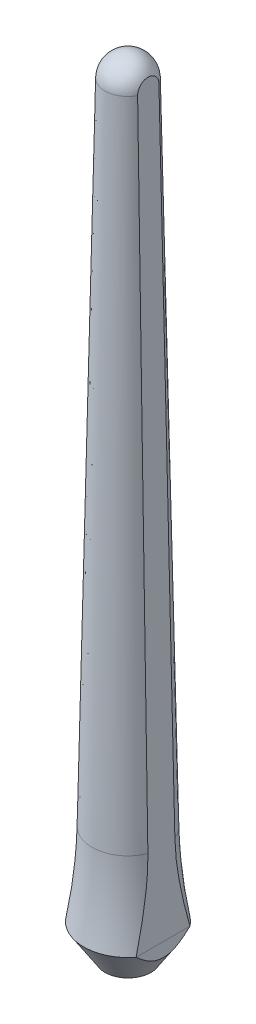
from build123d import *

# Parameters (mm, degrees)
SKETCH2_R          = 2.2
CUT_EXTRUDE1_DEPTH = 14
CUT_EXTRUDE2_DEPTH = 10
CHAMFER1_SIZE      = 0.2
CHAMFER1_SIZE2     = 0.746410162
CHAMFER2_SIZE      = 0.5


with BuildPart() as part:
    # Sketch1 → Revolve1 (revolve)
    with BuildSketch(Plane.XY):
        with BuildLine():
            Line((0, 0), (0, 120))
            ThreePointArc((0, 120), (2.450254417, 118.999536357), (3.5, 116.569987341))
            Line((3.5, 116.569987341), (5.5, 17.561999145))
            ThreePointArc((5.5, 17.561999145), (5.876826993, 11.256304757), (6.75, 5))
            Line((6.75, 5), (3.5, 0))
            Line((3.5, 0), (0, 0))
        make_face()
    revolve(axis=Axis((0, 0, 0), (0, -1, 0)))

    # Sketch2 → Cut-Extrude1 (cut)
    with BuildSketch(Plane.XZ):
        Circle(SKETCH2_R)
    extrude(amount=-CUT_EXTRUDE1_DEPTH, mode=Mode.SUBTRACT)

    # Sketch3 → Cut-Extrude2 (cut, symmetric)
    with BuildSketch(Plane.XY):
        Polygon((2.8286269, 130), (5.858685439, -20), (20, -20), (20, 130), align=None)
    extrude(amount=CUT_EXTRUDE2_DEPTH, both=True, mode=Mode.SUBTRACT)

    # Chamfer1
    chamfer1_edges = [part.edges().sort_by_distance(p)[0] for p in [
        (-2.2, 0, 0),
    ]]
    chamfer1_side = [part.faces().sort_by_distance(p)[0] for p in [
        (-3.401005051, 0, 0),
    ]]
    chamfer(chamfer1_edges, length=CHAMFER1_SIZE, length2=CHAMFER1_SIZE2, reference=chamfer1_side[0])


with BuildPart() as body_2:
    # Split1: the piece on the far side of the plane
    add(part.part)
    split(bisect_by=Plane(origin=(0, 5, 0), x_dir=(0, 0, -1), z_dir=(0, -1, 0)), keep=Keep.BOTTOM)

    # Chamfer2
    chamfer2_edges = [body_2.edges().sort_by_distance(p)[0] for p in [
        (-2.2, 14, 0),
    ]]
    chamfer(chamfer2_edges, length=CHAMFER2_SIZE)


with BuildPart() as part_1:
    add(part.part)

    # Split1
    split(bisect_by=Plane(origin=(0, 5, 0), x_dir=(0, 0, -1), z_dir=(0, -1, 0)), keep=Keep.TOP)


solid = Compound([body_2.part, part_1.part])
